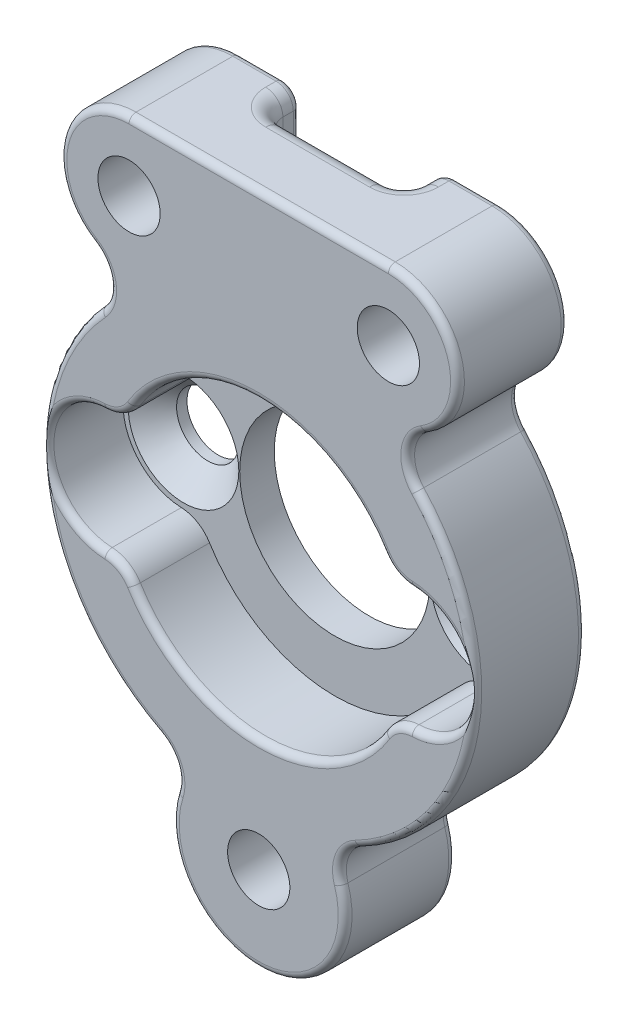
from build123d import *

# Parameters (mm, degrees)
SKETCH1_R           = 6.985
SKETCH1_R_2         = 2.286
BOSS_EXTRUDE1_DEPTH = 8.128
SKETCH2_R           = 4.445
CUT_EXTRUDE1_DEPTH  = 5.588
SKETCH3_R           = 10.795
CUT_EXTRUDE2_DEPTH  = 5.588
FILLET1_R           = 2.54
CHAMFER1_SIZE       = 1.778
FILLET2_R           = 2.54
SKETCH4_W           = 10.16
SKETCH4_H           = 12.7
CUT_EXTRUDE3_DEPTH  = 2.54
FILLET4_R           = 1.27
FILLET5_R           = 0.508


with BuildPart() as part:
    # Sketch1 → Boss-Extrude1 (new body)
    with BuildSketch(Plane.XY):
        with BuildLine():
            Line((-9.525, 24.13), (9.525, 24.13))
            ThreePointArc((9.525, 24.13), (14.605, 19.05), (9.525, 13.97))
            Line((9.525, 13.97), (7.540207225, 13.97))
            ThreePointArc((7.540207225, 13.97), (15.812609638, -1.406058835), (4.956967161, -15.08125))
            ThreePointArc((4.956967161, -15.08125), (0, -25.4), (-4.956967161, -15.08125))
            ThreePointArc((-4.956967161, -15.08125), (-15.812609638, -1.406058835), (-7.540207225, 13.97))
            Line((-7.540207225, 13.97), (-9.525, 13.97))
            ThreePointArc((-9.525, 13.97), (-14.605, 19.05), (-9.525, 24.13))
        make_face()
        Circle(SKETCH1_R, mode=Mode.SUBTRACT)
        with Locations((-11.1125, 0)):
            Circle(SKETCH1_R_2, mode=Mode.SUBTRACT)
        with Locations((11.1125, 0)):
            Circle(SKETCH1_R_2, mode=Mode.SUBTRACT)
        with Locations(Location((0, -19.05, 0), (0, 0, 180))):
            Circle(SKETCH1_R_2, mode=Mode.SUBTRACT)
        with Locations((-9.525, 19.05)):
            Circle(SKETCH1_R_2, mode=Mode.SUBTRACT)
        with Locations((9.525, 19.05)):
            Circle(SKETCH1_R_2, mode=Mode.SUBTRACT)
    extrude(amount=BOSS_EXTRUDE1_DEPTH)

    # Sketch2 → Cut-Extrude1 (cut)
    with BuildSketch(Plane.XY.offset(8.128)):
        with Locations((-11.1125, 0)):
            Circle(SKETCH2_R)
        with Locations((11.1125, 0)):
            Circle(SKETCH2_R)
    extrude(amount=-CUT_EXTRUDE1_DEPTH, mode=Mode.SUBTRACT)

    # Sketch3 → Cut-Extrude2 (cut)
    with BuildSketch(Plane.XY.offset(8.128)):
        Circle(SKETCH3_R)
    extrude(amount=-CUT_EXTRUDE2_DEPTH, mode=Mode.SUBTRACT)

    # Fillet1
    fillet1_edges = [part.edges().sort_by_distance(p)[0] for p in [
        (4.956967161, -15.08125, 4.064),
        (-4.956967161, -15.08125, 4.064),
        (7.540207225, 13.97, 4.064),
        (-7.540207225, 13.97, 4.064),
    ]]
    fillet(fillet1_edges, radius=FILLET1_R)

    # Chamfer1
    chamfer1_edges = [part.edges().sort_by_distance(p)[0] for p in [
        (-13.3985, 0, 2.54),
        (8.8265, 0, 2.54),
    ]]
    chamfer(chamfer1_edges, length=CHAMFER1_SIZE)

    # Fillet2
    fillet2_edges = [part.edges().sort_by_distance(p)[0] for p in [
        (-9.910535714, -4.279404965, 5.334),
        (-9.910535714, 4.279404965, 5.334),
        (9.910535714, -4.279404965, 5.334),
        (9.910535714, 4.279404965, 5.334),
    ]]
    fillet(fillet2_edges, radius=FILLET2_R)

    # Sketch4 → Cut-Extrude3 (cut)
    with BuildSketch(Plane(origin=(0, 0, 0), x_dir=(-1, 0, 0), z_dir=(0, 0, -1))):
        with Locations((0, 19.05)):
            Rectangle(SKETCH4_W, SKETCH4_H)
    extrude(amount=-CUT_EXTRUDE3_DEPTH, mode=Mode.SUBTRACT)

    # Fillet4
    fillet4_edges = [part.edges().sort_by_distance(p)[0] for p in [
        (0, 24.13, 2.54),
        (-5.08, 24.13, 1.27),
        (5.08, 24.13, 1.27),
        (5.08, 18.415, 2.54),
        (-5.08, 18.415, 2.54),
        (0, 12.7, 2.54),
    ]]
    fillet(fillet4_edges, radius=FILLET4_R)

    # Fillet5
    # the kernel refuses this fillet: 0.508 mm, written as the material it takes off along each edge
    with BuildSketch(Plane(origin=(0, 0, 8.128), x_dir=(0.7323099568525826, 0.6809714583553181, 0), z_dir=(-0.6809714583553181, 0.7323099568525826, 0))) as fillet5_piece_1:
        with BuildLine():
            CenterArc((15.875 - FILLET5_R, FILLET5_R), FILLET5_R, 270, 90)
            Line((15.875 - FILLET5_R, 0), (15.875 - FILLET5_R, -FILLET5_R * 0.02))
            Line((15.875 - FILLET5_R, -FILLET5_R * 0.02), (15.875 + FILLET5_R * 0.02, -FILLET5_R * 0.02))
            Line((15.875 + FILLET5_R * 0.02, -FILLET5_R * 0.02), (15.875 + FILLET5_R * 0.02, FILLET5_R))
            Line((15.875 + FILLET5_R * 0.02, FILLET5_R), (15.875, FILLET5_R))
        make_face()
    revolve(axis=Axis((0, 0, 8.128), (0, 0, -1)), revolution_arc=105.534005008, mode=Mode.SUBTRACT)
    with BuildSketch(Plane(origin=(0, -19.05, 0), x_dir=(0.9528086837110071, 0.3035714285714286, 0), z_dir=(-0.3035714285714286, 0.9528086837110071, 0))) as fillet5_piece_2:
        with BuildLine():
            CenterArc((6.35 - FILLET5_R, -FILLET5_R), FILLET5_R, 0, 90)
            Line((6.35, -FILLET5_R), (6.35 + FILLET5_R * 0.02, -FILLET5_R))
            Line((6.35 + FILLET5_R * 0.02, -FILLET5_R), (6.35 + FILLET5_R * 0.02, FILLET5_R * 0.02))
            Line((6.35 + FILLET5_R * 0.02, FILLET5_R * 0.02), (6.35 - FILLET5_R, FILLET5_R * 0.02))
            Line((6.35 - FILLET5_R, FILLET5_R * 0.02), (6.35 - FILLET5_R, 0))
        make_face()
    revolve(axis=Axis((0, -19.05, 0), (0, 0, -1)), revolution_arc=215.344476517, mode=Mode.SUBTRACT)
    with BuildSketch(Plane(origin=(0, -19.05, 8.128), x_dir=(0.9528086837110071, 0.3035714285714286, 0), z_dir=(-0.3035714285714286, 0.9528086837110071, 0))) as fillet5_piece_3:
        with BuildLine():
            CenterArc((6.35 - FILLET5_R, FILLET5_R), FILLET5_R, 270, 90)
            Line((6.35 - FILLET5_R, 0), (6.35 - FILLET5_R, -FILLET5_R * 0.02))
            Line((6.35 - FILLET5_R, -FILLET5_R * 0.02), (6.35 + FILLET5_R * 0.02, -FILLET5_R * 0.02))
            Line((6.35 + FILLET5_R * 0.02, -FILLET5_R * 0.02), (6.35 + FILLET5_R * 0.02, FILLET5_R))
            Line((6.35 + FILLET5_R * 0.02, FILLET5_R), (6.35, FILLET5_R))
        make_face()
    revolve(axis=Axis((0, -19.05, 8.128), (0, 0, -1)), revolution_arc=215.344476517, mode=Mode.SUBTRACT)
    with BuildSketch(Plane(origin=(0, 0, 0), x_dir=(-0.4599766059294518, -0.8879310344827586, 0), z_dir=(0.8879310344827586, -0.4599766059294518, 0))) as fillet5_piece_4:
        with BuildLine():
            CenterArc((15.875 - FILLET5_R, -FILLET5_R), FILLET5_R, 0, 90)
            Line((15.875, -FILLET5_R), (15.875 + FILLET5_R * 0.02, -FILLET5_R))
            Line((15.875 + FILLET5_R * 0.02, -FILLET5_R), (15.875 + FILLET5_R * 0.02, FILLET5_R * 0.02))
            Line((15.875 + FILLET5_R * 0.02, FILLET5_R * 0.02), (15.875 - FILLET5_R, FILLET5_R * 0.02))
            Line((15.875 - FILLET5_R, FILLET5_R * 0.02), (15.875 - FILLET5_R, 0))
        make_face()
    revolve(axis=Axis((0, 0, 0), (0, 0, -1)), revolution_arc=105.534005008, mode=Mode.SUBTRACT)
    with BuildSketch(Plane(origin=(0, 0, 8.128), x_dir=(-0.4599766059294518, -0.8879310344827586, 0), z_dir=(0.8879310344827586, -0.4599766059294518, 0))) as fillet5_piece_5:
        with BuildLine():
            CenterArc((15.875 - FILLET5_R, FILLET5_R), FILLET5_R, 270, 90)
            Line((15.875 - FILLET5_R, 0), (15.875 - FILLET5_R, -FILLET5_R * 0.02))
            Line((15.875 - FILLET5_R, -FILLET5_R * 0.02), (15.875 + FILLET5_R * 0.02, -FILLET5_R * 0.02))
            Line((15.875 + FILLET5_R * 0.02, -FILLET5_R * 0.02), (15.875 + FILLET5_R * 0.02, FILLET5_R))
            Line((15.875 + FILLET5_R * 0.02, FILLET5_R), (15.875, FILLET5_R))
        make_face()
    revolve(axis=Axis((0, 0, 8.128), (0, 0, -1)), revolution_arc=105.534005008, mode=Mode.SUBTRACT)
    with BuildSketch(Plane(origin=(9.525, 19.05, 0), x_dir=(0, 1, 0), z_dir=(-1, 0, 0))) as fillet5_piece_6:
        with BuildLine():
            CenterArc((5.08 - FILLET5_R, -FILLET5_R), FILLET5_R, 0, 90)
            Line((5.08, -FILLET5_R), (5.08 + FILLET5_R * 0.02, -FILLET5_R))
            Line((5.08 + FILLET5_R * 0.02, -FILLET5_R), (5.08 + FILLET5_R * 0.02, FILLET5_R * 0.02))
            Line((5.08 + FILLET5_R * 0.02, FILLET5_R * 0.02), (5.08 - FILLET5_R, FILLET5_R * 0.02))
            Line((5.08 - FILLET5_R, FILLET5_R * 0.02), (5.08 - FILLET5_R, 0))
        make_face()
    revolve(axis=Axis((9.525, 19.05, 0), (0, 0, -1)), revolution_arc=148.684579395, mode=Mode.SUBTRACT)
    with BuildSketch(Plane(origin=(9.525, 19.05, 8.128), x_dir=(0, 1, 0), z_dir=(-1, 0, 0))) as fillet5_piece_7:
        with BuildLine():
            CenterArc((5.08 - FILLET5_R, FILLET5_R), FILLET5_R, 270, 90)
            Line((5.08 - FILLET5_R, 0), (5.08 - FILLET5_R, -FILLET5_R * 0.02))
            Line((5.08 - FILLET5_R, -FILLET5_R * 0.02), (5.08 + FILLET5_R * 0.02, -FILLET5_R * 0.02))
            Line((5.08 + FILLET5_R * 0.02, -FILLET5_R * 0.02), (5.08 + FILLET5_R * 0.02, FILLET5_R))
            Line((5.08 + FILLET5_R * 0.02, FILLET5_R), (5.08, FILLET5_R))
        make_face()
    revolve(axis=Axis((9.525, 19.05, 8.128), (0, 0, -1)), revolution_arc=148.684579395, mode=Mode.SUBTRACT)
    with BuildSketch(Plane(origin=(8.470469194, -16.351249998, 0), x_dir=(-0.45997660486444175, 0.8879310350344677, 0), z_dir=(0.8879310350344677, 0.45997660486444175, 0))) as fillet5_piece_8:
        with BuildLine():
            CenterArc((2.539999996 + FILLET5_R * 0.999999997809, FILLET5_R), FILLET5_R, 180, 90)
            Line((2.539999996 - FILLET5_R * 2.19129001908e-09, FILLET5_R), (2.539999996 - FILLET5_R * 0.0200000021913, FILLET5_R))
            Line((2.539999996 - FILLET5_R * 0.0200000021913, FILLET5_R), (2.539999996 - FILLET5_R * 0.02, -FILLET5_R * 0.02))
            Line((2.539999996 - FILLET5_R * 0.02, -FILLET5_R * 0.02), (2.539999996 + FILLET5_R * 0.999999997809, -FILLET5_R * 0.02))
            Line((2.539999996 + FILLET5_R * 0.999999997809, -FILLET5_R * 0.02), (2.539999996 + FILLET5_R * 0.999999997809, 0))
        make_face()
    revolve(axis=Axis((8.470469194, -16.351249998, 0), (0, 0, 1)), revolution_arc=80.286640459, mode=Mode.SUBTRACT)
    with BuildSketch(Plane(origin=(8.470469194, -16.351249998, 8.128), x_dir=(-0.45997660486444014, 0.8879310350344687, 0), z_dir=(0.8879310350344687, 0.45997660486444014, 0))) as fillet5_piece_9:
        with BuildLine():
            CenterArc((2.539999996 + FILLET5_R * 0.999999997809, -FILLET5_R), FILLET5_R, 90, 90)
            Line((2.539999996 + FILLET5_R * 0.999999997809, 0), (2.539999996 + FILLET5_R * 0.999999997809, FILLET5_R * 0.02))
            Line((2.539999996 + FILLET5_R * 0.999999997809, FILLET5_R * 0.02), (2.539999996 - FILLET5_R * 0.02, FILLET5_R * 0.02))
            Line((2.539999996 - FILLET5_R * 0.02, FILLET5_R * 0.02), (2.539999996 - FILLET5_R * 0.0200000021913, -FILLET5_R))
            Line((2.539999996 - FILLET5_R * 0.0200000021913, -FILLET5_R), (2.539999996 - FILLET5_R * 2.19128914489e-09, -FILLET5_R))
        make_face()
    revolve(axis=Axis((8.470469194, -16.351249998, 8.128), (0, 0, 1)), revolution_arc=80.286640459, mode=Mode.SUBTRACT)
    with BuildSketch(Plane(origin=(-8.470469194, -16.351249998, 0), x_dir=(0.9528086833468931, -0.30357142971426027, 0), z_dir=(-0.30357142971426027, -0.9528086833468931, 0))) as fillet5_piece_10:
        with BuildLine():
            CenterArc((2.539999996 + FILLET5_R * 0.999999997809, FILLET5_R), FILLET5_R, 180, 90)
            Line((2.539999996 - FILLET5_R * 2.19129001908e-09, FILLET5_R), (2.539999996 - FILLET5_R * 0.0200000021913, FILLET5_R))
            Line((2.539999996 - FILLET5_R * 0.0200000021913, FILLET5_R), (2.539999996 - FILLET5_R * 0.02, -FILLET5_R * 0.02))
            Line((2.539999996 - FILLET5_R * 0.02, -FILLET5_R * 0.02), (2.539999996 + FILLET5_R * 0.999999997809, -FILLET5_R * 0.02))
            Line((2.539999996 + FILLET5_R * 0.999999997809, -FILLET5_R * 0.02), (2.539999996 + FILLET5_R * 0.999999997809, 0))
        make_face()
    revolve(axis=Axis((-8.470469194, -16.351249998, 0), (0, 0, 1)), revolution_arc=80.286640459, mode=Mode.SUBTRACT)
    with BuildSketch(Plane(origin=(-8.470469194, -16.351249998, 8.128), x_dir=(0.9528086833468932, -0.3035714297142598, 0), z_dir=(-0.3035714297142598, -0.9528086833468932, 0))) as fillet5_piece_11:
        with BuildLine():
            CenterArc((2.539999996 + FILLET5_R * 0.999999997809, -FILLET5_R), FILLET5_R, 90, 90)
            Line((2.539999996 + FILLET5_R * 0.999999997809, 0), (2.539999996 + FILLET5_R * 0.999999997809, FILLET5_R * 0.02))
            Line((2.539999996 + FILLET5_R * 0.999999997809, FILLET5_R * 0.02), (2.539999996 - FILLET5_R * 0.02, FILLET5_R * 0.02))
            Line((2.539999996 - FILLET5_R * 0.02, FILLET5_R * 0.02), (2.539999996 - FILLET5_R * 0.0200000021913, -FILLET5_R))
            Line((2.539999996 - FILLET5_R * 0.0200000021913, -FILLET5_R), (2.539999996 - FILLET5_R * 2.19129613842e-09, -FILLET5_R))
        make_face()
    revolve(axis=Axis((-8.470469194, -16.351249998, 8.128), (0, 0, 1)), revolution_arc=80.286640459, mode=Mode.SUBTRACT)
    with BuildSketch(Plane(origin=(13.485487849, 12.540089406, 0), x_dir=(-0.7323099555866797, -0.6809714597166574, 0), z_dir=(0.6809714597166574, -0.7323099555866797, 0))) as fillet5_piece_12:
        with BuildLine():
            CenterArc((2.539999996 + FILLET5_R * 0.999999995586, -FILLET5_R), FILLET5_R, 90, 90)
            Line((2.539999996 - FILLET5_R * 4.4137117408e-09, -FILLET5_R), (2.539999996 - FILLET5_R * 0.0200000044137, -FILLET5_R))
            Line((2.539999996 - FILLET5_R * 0.0200000044137, -FILLET5_R), (2.539999996 - FILLET5_R * 0.02, FILLET5_R * 0.02))
            Line((2.539999996 - FILLET5_R * 0.02, FILLET5_R * 0.02), (2.539999996 + FILLET5_R * 0.999999995586, FILLET5_R * 0.02))
            Line((2.539999996 + FILLET5_R * 0.999999995586, FILLET5_R * 0.02), (2.539999996 + FILLET5_R * 0.999999995586, 0))
        make_face()
    revolve(axis=Axis((13.485487849, 12.540089406, 0), (0, 0, -1)), revolution_arc=101.604182552, mode=Mode.SUBTRACT)
    with BuildSketch(Plane(origin=(13.485487849, 12.540089406, 8.128), x_dir=(-0.7323099555866831, -0.6809714597166536, 0), z_dir=(0.6809714597166536, -0.7323099555866831, 0))) as fillet5_piece_13:
        with BuildLine():
            CenterArc((2.539999996 + FILLET5_R * 0.999999995586, FILLET5_R), FILLET5_R, 180, 90)
            Line((2.539999996 + FILLET5_R * 0.999999995586, 0), (2.539999996 + FILLET5_R * 0.999999995586, -FILLET5_R * 0.02))
            Line((2.539999996 + FILLET5_R * 0.999999995586, -FILLET5_R * 0.02), (2.539999996 - FILLET5_R * 0.02, -FILLET5_R * 0.02))
            Line((2.539999996 - FILLET5_R * 0.02, -FILLET5_R * 0.02), (2.539999996 - FILLET5_R * 0.0200000044137, FILLET5_R))
            Line((2.539999996 - FILLET5_R * 0.0200000044137, FILLET5_R), (2.539999996 - FILLET5_R * 4.4137213569e-09, FILLET5_R))
        make_face()
    revolve(axis=Axis((13.485487849, 12.540089406, 8.128), (0, 0, -1)), revolution_arc=101.604182552, mode=Mode.SUBTRACT)
    with BuildSketch(Plane(origin=(-13.485487849, 12.540089406, 0), x_dir=(0.7323099555866819, -0.680971459716655, 0), z_dir=(-0.680971459716655, -0.7323099555866819, 0))) as fillet5_piece_14:
        with BuildLine():
            CenterArc((2.539999996 + FILLET5_R * 0.999999995586, FILLET5_R), FILLET5_R, 180, 90)
            Line((2.539999996 - FILLET5_R * 4.4137117408e-09, FILLET5_R), (2.539999996 - FILLET5_R * 0.0200000044137, FILLET5_R))
            Line((2.539999996 - FILLET5_R * 0.0200000044137, FILLET5_R), (2.539999996 - FILLET5_R * 0.02, -FILLET5_R * 0.02))
            Line((2.539999996 - FILLET5_R * 0.02, -FILLET5_R * 0.02), (2.539999996 + FILLET5_R * 0.999999995586, -FILLET5_R * 0.02))
            Line((2.539999996 + FILLET5_R * 0.999999995586, -FILLET5_R * 0.02), (2.539999996 + FILLET5_R * 0.999999995586, 0))
        make_face()
    revolve(axis=Axis((-13.485487849, 12.540089406, 0), (0, 0, 1)), revolution_arc=101.604182552, mode=Mode.SUBTRACT)
    with BuildSketch(Plane(origin=(-13.485487849, 12.540089406, 8.128), x_dir=(0.7323099555866839, -0.680971459716653, 0), z_dir=(-0.680971459716653, -0.7323099555866839, 0))) as fillet5_piece_15:
        with BuildLine():
            CenterArc((2.539999996 + FILLET5_R * 0.999999995586, -FILLET5_R), FILLET5_R, 90, 90)
            Line((2.539999996 + FILLET5_R * 0.999999995586, 0), (2.539999996 + FILLET5_R * 0.999999995586, FILLET5_R * 0.02))
            Line((2.539999996 + FILLET5_R * 0.999999995586, FILLET5_R * 0.02), (2.539999996 - FILLET5_R * 0.02, FILLET5_R * 0.02))
            Line((2.539999996 - FILLET5_R * 0.02, FILLET5_R * 0.02), (2.539999996 - FILLET5_R * 0.0200000044137, -FILLET5_R))
            Line((2.539999996 - FILLET5_R * 0.0200000044137, -FILLET5_R), (2.539999996 - FILLET5_R * 4.4137117408e-09, -FILLET5_R))
        make_face()
    revolve(axis=Axis((-13.485487849, 12.540089406, 8.128), (0, 0, 1)), revolution_arc=101.604182552, mode=Mode.SUBTRACT)
    with BuildSketch(Plane(origin=(-11.1125, 0, 8.128), x_dir=(-0.035714285714286004, 0.9993620414023731, 0), z_dir=(0.9993620414023731, 0.035714285714286004, 0))) as fillet5_piece_16:
        with BuildLine():
            CenterArc((4.445 + FILLET5_R, -FILLET5_R), FILLET5_R, 90, 90)
            Line((4.445, -FILLET5_R), (4.445 - FILLET5_R * 0.02, -FILLET5_R))
            Line((4.445 - FILLET5_R * 0.02, -FILLET5_R), (4.445 - FILLET5_R * 0.02, FILLET5_R * 0.02))
            Line((4.445 - FILLET5_R * 0.02, FILLET5_R * 0.02), (4.445 + FILLET5_R, FILLET5_R * 0.02))
            Line((4.445 + FILLET5_R, FILLET5_R * 0.02), (4.445 + FILLET5_R, 0))
        make_face()
    revolve(axis=Axis((-11.1125, 0, 8.128), (0, 0, 1)), revolution_arc=175.906573805, mode=Mode.SUBTRACT)
    with BuildSketch(Plane(origin=(0, 0, 8.128), x_dir=(0.8520408163265305, 0.523475355020291, 0), z_dir=(0.523475355020291, -0.8520408163265305, 0))) as fillet5_piece_17:
        with BuildLine():
            CenterArc((10.795 + FILLET5_R, -FILLET5_R), FILLET5_R, 90, 90)
            Line((10.795, -FILLET5_R), (10.795 - FILLET5_R * 0.02, -FILLET5_R))
            Line((10.795 - FILLET5_R * 0.02, -FILLET5_R), (10.795 - FILLET5_R * 0.02, FILLET5_R * 0.02))
            Line((10.795 - FILLET5_R * 0.02, FILLET5_R * 0.02), (10.795 + FILLET5_R, FILLET5_R * 0.02))
            Line((10.795 + FILLET5_R, FILLET5_R * 0.02), (10.795 + FILLET5_R, 0))
        make_face()
    revolve(axis=Axis((0, 0, 8.128), (0, 0, 1)), revolution_arc=116.868676998, mode=Mode.SUBTRACT)
    with BuildSketch(Plane(origin=(11.1125, 0, 8.128), x_dir=(0.0357142857142864, 0.999362041402373, 0), z_dir=(-0.999362041402373, 0.0357142857142864, 0))) as fillet5_piece_18:
        with BuildLine():
            CenterArc((4.445 + FILLET5_R, FILLET5_R), FILLET5_R, 180, 90)
            Line((4.445, FILLET5_R), (4.445 - FILLET5_R * 0.02, FILLET5_R))
            Line((4.445 - FILLET5_R * 0.02, FILLET5_R), (4.445 - FILLET5_R * 0.02, -FILLET5_R * 0.02))
            Line((4.445 - FILLET5_R * 0.02, -FILLET5_R * 0.02), (4.445 + FILLET5_R, -FILLET5_R * 0.02))
            Line((4.445 + FILLET5_R, -FILLET5_R * 0.02), (4.445 + FILLET5_R, 0))
        make_face()
    revolve(axis=Axis((11.1125, 0, 8.128), (0, 0, -1)), revolution_arc=175.906573805, mode=Mode.SUBTRACT)
    with BuildSketch(Plane(origin=(0, 0, 8.128), x_dir=(-0.8520408163265305, -0.5234753550202906, 0), z_dir=(-0.5234753550202906, 0.8520408163265305, 0))) as fillet5_piece_19:
        with BuildLine():
            CenterArc((10.795 + FILLET5_R, -FILLET5_R), FILLET5_R, 90, 90)
            Line((10.795, -FILLET5_R), (10.795 - FILLET5_R * 0.02, -FILLET5_R))
            Line((10.795 - FILLET5_R * 0.02, -FILLET5_R), (10.795 - FILLET5_R * 0.02, FILLET5_R * 0.02))
            Line((10.795 - FILLET5_R * 0.02, FILLET5_R * 0.02), (10.795 + FILLET5_R, FILLET5_R * 0.02))
            Line((10.795 + FILLET5_R, FILLET5_R * 0.02), (10.795 + FILLET5_R, 0))
        make_face()
    revolve(axis=Axis((0, 0, 8.128), (0, 0, 1)), revolution_arc=116.868676998, mode=Mode.SUBTRACT)
    with BuildSketch(Plane(origin=(11.361964276, 6.980543842, 8.128), x_dir=(-0.8520408182798835, -0.5234753518408927, 0), z_dir=(-0.5234753518408927, 0.8520408182798835, 0))) as fillet5_piece_20:
        with BuildLine():
            CenterArc((2.539999982 - FILLET5_R * 1.00000000469, -FILLET5_R), FILLET5_R, 0, 90)
            Line((2.539999982 - FILLET5_R * 4.68538069235e-09, -FILLET5_R), (2.539999982 + FILLET5_R * 0.0199999953146, -FILLET5_R))
            Line((2.539999982 + FILLET5_R * 0.0199999953146, -FILLET5_R), (2.539999982 + FILLET5_R * 0.02, FILLET5_R * 0.02))
            Line((2.539999982 + FILLET5_R * 0.02, FILLET5_R * 0.02), (2.539999982 - FILLET5_R * 1.00000000469, FILLET5_R * 0.02))
            Line((2.539999982 - FILLET5_R * 1.00000000469, FILLET5_R * 0.02), (2.539999982 - FILLET5_R * 1.00000000469, 0))
        make_face()
    revolve(axis=Axis((11.361964276, 6.980543842, 8.128), (0, 0, 1)), revolution_arc=56.387625829, mode=Mode.SUBTRACT)
    with BuildSketch(Plane(origin=(11.361964276, -6.980543842, 8.128), x_dir=(-0.8520408182798824, 0.5234753518408948, 0), z_dir=(-0.5234753518408948, -0.8520408182798824, 0))) as fillet5_piece_21:
        with BuildLine():
            CenterArc((2.539999982 - FILLET5_R * 1.00000000469, FILLET5_R), FILLET5_R, 270, 90)
            Line((2.539999982 - FILLET5_R * 4.68537282463e-09, FILLET5_R), (2.539999982 + FILLET5_R * 0.0199999953146, FILLET5_R))
            Line((2.539999982 + FILLET5_R * 0.0199999953146, FILLET5_R), (2.539999982 + FILLET5_R * 0.02, -FILLET5_R * 0.02))
            Line((2.539999982 + FILLET5_R * 0.02, -FILLET5_R * 0.02), (2.539999982 - FILLET5_R * 1.00000000469, -FILLET5_R * 0.02))
            Line((2.539999982 - FILLET5_R * 1.00000000469, -FILLET5_R * 0.02), (2.539999982 - FILLET5_R * 1.00000000469, 0))
        make_face()
    revolve(axis=Axis((11.361964276, -6.980543842, 8.128), (0, 0, -1)), revolution_arc=56.387625829, mode=Mode.SUBTRACT)
    with BuildSketch(Plane(origin=(-11.361964276, -6.980543842, 8.128), x_dir=(0.03571428198515804, 0.9993620415356411, 0), z_dir=(-0.9993620415356411, 0.03571428198515804, 0))) as fillet5_piece_22:
        with BuildLine():
            CenterArc((2.539999982 - FILLET5_R * 1.00000000469, FILLET5_R), FILLET5_R, 270, 90)
            Line((2.539999982 - FILLET5_R * 4.6853859375e-09, FILLET5_R), (2.539999982 + FILLET5_R * 0.0199999953146, FILLET5_R))
            Line((2.539999982 + FILLET5_R * 0.0199999953146, FILLET5_R), (2.539999982 + FILLET5_R * 0.02, -FILLET5_R * 0.02))
            Line((2.539999982 + FILLET5_R * 0.02, -FILLET5_R * 0.02), (2.539999982 - FILLET5_R * 1.00000000469, -FILLET5_R * 0.02))
            Line((2.539999982 - FILLET5_R * 1.00000000469, -FILLET5_R * 0.02), (2.539999982 - FILLET5_R * 1.00000000469, 0))
        make_face()
    revolve(axis=Axis((-11.361964276, -6.980543842, 8.128), (0, 0, -1)), revolution_arc=56.387625829, mode=Mode.SUBTRACT)
    with BuildSketch(Plane(origin=(-11.361964276, 6.980543842, 8.128), x_dir=(0.8520408182798841, -0.5234753518408919, 0), z_dir=(0.5234753518408919, 0.8520408182798841, 0))) as fillet5_piece_23:
        with BuildLine():
            CenterArc((2.539999982 - FILLET5_R * 1.00000000469, FILLET5_R), FILLET5_R, 270, 90)
            Line((2.539999982 - FILLET5_R * 4.68538506331e-09, FILLET5_R), (2.539999982 + FILLET5_R * 0.0199999953146, FILLET5_R))
            Line((2.539999982 + FILLET5_R * 0.0199999953146, FILLET5_R), (2.539999982 + FILLET5_R * 0.02, -FILLET5_R * 0.02))
            Line((2.539999982 + FILLET5_R * 0.02, -FILLET5_R * 0.02), (2.539999982 - FILLET5_R * 1.00000000469, -FILLET5_R * 0.02))
            Line((2.539999982 - FILLET5_R * 1.00000000469, -FILLET5_R * 0.02), (2.539999982 - FILLET5_R * 1.00000000469, 0))
        make_face()
    revolve(axis=Axis((-11.361964276, 6.980543842, 8.128), (0, 0, -1)), revolution_arc=56.387625829, mode=Mode.SUBTRACT)
    with BuildSketch(Plane(origin=(-5.08, 22.86, 0), x_dir=(-1, 0, 0), z_dir=(0, -1, 0)), Plane(origin=(5.08, 12.7, 0), x_dir=(1, 0, 0), z_dir=(0, 1, 0))) as fillet5_piece_24:
        with BuildLine():
            CenterArc((FILLET5_R, -FILLET5_R), FILLET5_R, 90, 90)
            Line((0, -FILLET5_R), (-FILLET5_R * 0.02, -FILLET5_R))
            Line((-FILLET5_R * 0.02, -FILLET5_R), (-FILLET5_R * 0.02, FILLET5_R * 0.02))
            Line((-FILLET5_R * 0.02, FILLET5_R * 0.02), (FILLET5_R, FILLET5_R * 0.02))
            Line((FILLET5_R, FILLET5_R * 0.02), (FILLET5_R, 0))
        make_face()
    extrude(amount=10.16, mode=Mode.SUBTRACT)
    with BuildSketch(Plane(origin=(-9.525, 24.13, 0), x_dir=(0, -1, 0), z_dir=(1, 0, 0)), Plane(origin=(6.35, 24.13, 0), x_dir=(0, -1, 0), z_dir=(1, 0, 0))) as fillet5_piece_25:
        with BuildLine():
            CenterArc((FILLET5_R, -FILLET5_R), FILLET5_R, 90, 90)
            Line((0, -FILLET5_R), (-FILLET5_R * 0.02, -FILLET5_R))
            Line((-FILLET5_R * 0.02, -FILLET5_R), (-FILLET5_R * 0.02, FILLET5_R * 0.02))
            Line((-FILLET5_R * 0.02, FILLET5_R * 0.02), (FILLET5_R, FILLET5_R * 0.02))
            Line((FILLET5_R, FILLET5_R * 0.02), (FILLET5_R, 0))
        make_face()
    extrude(amount=3.175, mode=Mode.SUBTRACT)
    with BuildSketch(Plane(origin=(6.35, 22.86, 0), x_dir=(0, 1, 0), z_dir=(1, 0, 0))) as fillet5_piece_26:
        with BuildLine():
            CenterArc((1.27 - FILLET5_R, FILLET5_R), FILLET5_R, 270, 90)
            Line((1.27, FILLET5_R), (1.27 + FILLET5_R * 0.02, FILLET5_R))
            Line((1.27 + FILLET5_R * 0.02, FILLET5_R), (1.27 + FILLET5_R * 0.02, -FILLET5_R * 0.02))
            Line((1.27 + FILLET5_R * 0.02, -FILLET5_R * 0.02), (1.27 - FILLET5_R, -FILLET5_R * 0.02))
            Line((1.27 - FILLET5_R, -FILLET5_R * 0.02), (1.27 - FILLET5_R, 0))
        make_face()
    revolve(axis=Axis((6.35, 22.86, 0), (0, 0, 1)), revolution_arc=90, mode=Mode.SUBTRACT)
    with BuildSketch(Plane(origin=(-6.35, 22.86, 0), x_dir=(0, 1, 0), z_dir=(-1, 0, 0))) as fillet5_piece_27:
        with BuildLine():
            CenterArc((1.27 - FILLET5_R, -FILLET5_R), FILLET5_R, 0, 90)
            Line((1.27, -FILLET5_R), (1.27 + FILLET5_R * 0.02, -FILLET5_R))
            Line((1.27 + FILLET5_R * 0.02, -FILLET5_R), (1.27 + FILLET5_R * 0.02, FILLET5_R * 0.02))
            Line((1.27 + FILLET5_R * 0.02, FILLET5_R * 0.02), (1.27 - FILLET5_R, FILLET5_R * 0.02))
            Line((1.27 - FILLET5_R, FILLET5_R * 0.02), (1.27 - FILLET5_R, 0))
        make_face()
    revolve(axis=Axis((-6.35, 22.86, 0), (0, 0, -1)), revolution_arc=90, mode=Mode.SUBTRACT)
    with BuildSketch(Plane(origin=(-9.525, 24.13, 8.128), x_dir=(0, 0, -1), z_dir=(1, 0, 0))) as fillet5_piece_28:
        with BuildLine():
            CenterArc((FILLET5_R, -FILLET5_R), FILLET5_R, 90, 90)
            Line((0, -FILLET5_R), (-FILLET5_R * 0.02, -FILLET5_R))
            Line((-FILLET5_R * 0.02, -FILLET5_R), (-FILLET5_R * 0.02, FILLET5_R * 0.02))
            Line((-FILLET5_R * 0.02, FILLET5_R * 0.02), (FILLET5_R, FILLET5_R * 0.02))
            Line((FILLET5_R, FILLET5_R * 0.02), (FILLET5_R, 0))
        make_face()
    extrude(amount=19.05, mode=Mode.SUBTRACT)
    with BuildSketch(Plane(origin=(-9.525, 19.05, 8.128), x_dir=(-0.5197490623937411, -0.8543189756413158, 0), z_dir=(0.8543189756413158, -0.5197490623937411, 0))) as fillet5_piece_29:
        with BuildLine():
            CenterArc((5.08 - FILLET5_R, FILLET5_R), FILLET5_R, 270, 90)
            Line((5.08 - FILLET5_R, 0), (5.08 - FILLET5_R, -FILLET5_R * 0.02))
            Line((5.08 - FILLET5_R, -FILLET5_R * 0.02), (5.08 + FILLET5_R * 0.02, -FILLET5_R * 0.02))
            Line((5.08 + FILLET5_R * 0.02, -FILLET5_R * 0.02), (5.08 + FILLET5_R * 0.02, FILLET5_R))
            Line((5.08 + FILLET5_R * 0.02, FILLET5_R), (5.08, FILLET5_R))
        make_face()
    revolve(axis=Axis((-9.525, 19.05, 8.128), (0, 0, -1)), revolution_arc=148.684579395, mode=Mode.SUBTRACT)
    with BuildSketch(Plane(origin=(-9.525, 19.05, 0), x_dir=(-0.5197490623937414, -0.8543189756413156, 0), z_dir=(0.8543189756413156, -0.5197490623937414, 0))) as fillet5_piece_30:
        with BuildLine():
            CenterArc((5.08 - FILLET5_R, -FILLET5_R), FILLET5_R, 0, 90)
            Line((5.08, -FILLET5_R), (5.08 + FILLET5_R * 0.02, -FILLET5_R))
            Line((5.08 + FILLET5_R * 0.02, -FILLET5_R), (5.08 + FILLET5_R * 0.02, FILLET5_R * 0.02))
            Line((5.08 + FILLET5_R * 0.02, FILLET5_R * 0.02), (5.08 - FILLET5_R, FILLET5_R * 0.02))
            Line((5.08 - FILLET5_R, FILLET5_R * 0.02), (5.08 - FILLET5_R, 0))
        make_face()
    revolve(axis=Axis((-9.525, 19.05, 0), (0, 0, -1)), revolution_arc=148.684579395, mode=Mode.SUBTRACT)
    with BuildSketch(Plane(origin=(0, 0, 0), x_dir=(0.7323099568525826, 0.6809714583553181, 0), z_dir=(-0.6809714583553181, 0.7323099568525826, 0))) as fillet5_piece_31:
        with BuildLine():
            CenterArc((15.875 - FILLET5_R, -FILLET5_R), FILLET5_R, 0, 90)
            Line((15.875, -FILLET5_R), (15.875 + FILLET5_R * 0.02, -FILLET5_R))
            Line((15.875 + FILLET5_R * 0.02, -FILLET5_R), (15.875 + FILLET5_R * 0.02, FILLET5_R * 0.02))
            Line((15.875 + FILLET5_R * 0.02, FILLET5_R * 0.02), (15.875 - FILLET5_R, FILLET5_R * 0.02))
            Line((15.875 - FILLET5_R, FILLET5_R * 0.02), (15.875 - FILLET5_R, 0))
        make_face()
    revolve(axis=Axis((0, 0, 0), (0, 0, -1)), revolution_arc=105.534005008, mode=Mode.SUBTRACT)


solid = part.part
